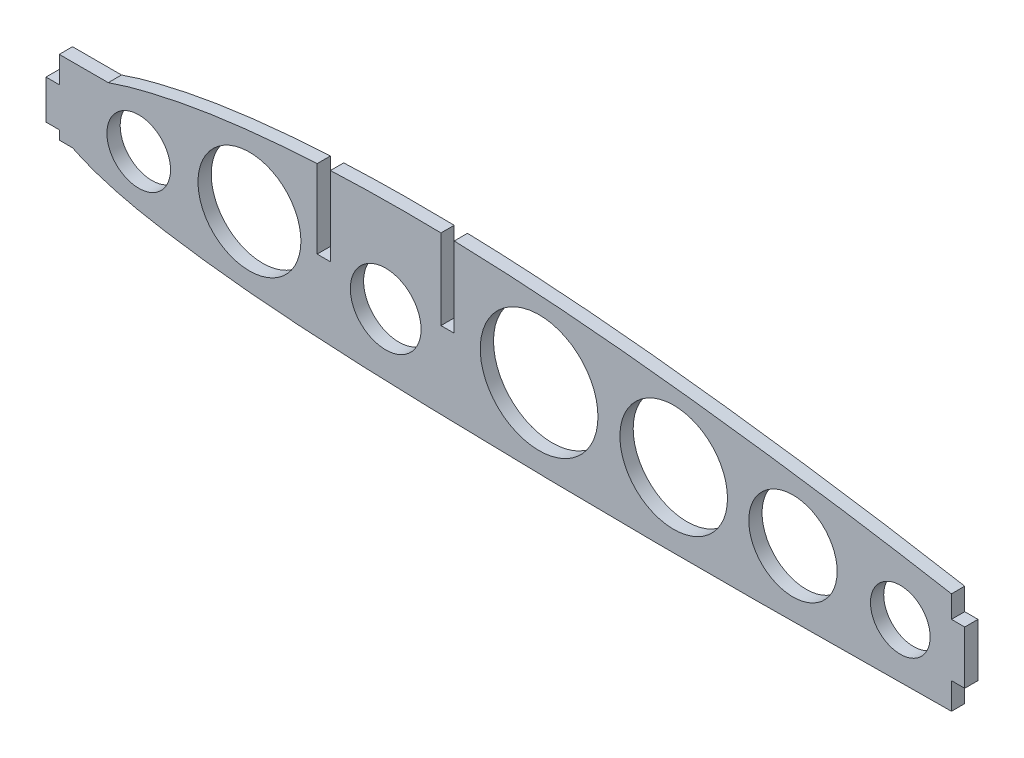
from build123d import *

# Parameters (mm, degrees)
STOCK_WING_STRUCTURESIZING_1_START = 350.5
STOCK_WING_STRUCTURESIZING_1_DEPTH = 3
CUT_EXTRUDE2_DEPTH                 = 278.894871602
CUT_EXTRUDE2_DEPTH_BACK            = 278.894871602
SKETCH3_R                          = 8
SKETCH3_W                          = 3
SKETCH3_H                          = 18.234468085
CUT_EXTRUDE5_DEPTH                 = 278.894871602
CUT_EXTRUDE5_DEPTH_BACK            = 278.894871602
SKETCH6_W                          = 72
SKETCH6_H                          = 36.832163157
SKETCH7_W                          = 3
SKETCH7_H                          = 29.829109924
CUT_EXTRUDE6_DEPTH                 = 3
BOSS_EXTRUDE1_DEPTH                = 3
SKETCH9_R                          = 7.192226029
SKETCH9_R_2                        = 11.636406179
SKETCH9_R_3                        = 13.307061318
SKETCH9_R_4                        = 12.161876466
SKETCH9_R_5                        = 9.990979792
SKETCH9_R_6                        = 6.753270012
CUT_EXTRUDE7_DEPTH                 = 10


# Read off the part's stored shape, not the designer's step: Stock-Wing_structureSizing-1
with BuildPart() as part:
    # Stock-Wing_structureSizing-1 outline → Stock-Wing_structureSizing-1 (new body)
    with BuildSketch(Plane.XY.offset(STOCK_WING_STRUCTURESIZING_1_START)):
        with BuildLine():
            Line((276.744987748, -9.975467242), (276.744987748, -2.791972149))
            add(Edge.make_bspline(
                [(276.744987748, -2.791972149), (265.3857023, -0.102525952), (253.985388892, 2.407220527), (231.123115134, 7.137179769), (219.66894224, 9.35664169), (202.450532833, 12.449607831), (196.704666185, 13.440005467), (185.197495984, 15.322846112), (179.436018194, 16.214183509), (167.896810084, 17.893728146), (162.119320772, 18.683464695), (150.549559093, 20.169132171), (144.757676972, 20.867539393), (133.154760401, 22.142823058), (127.340720117, 22.719276226), (115.726117513, 23.709424358), (109.921864102, 24.123286294), (92.520744809, 25.054695045), (80.935765142, 25.255529424), (63.589579679, 24.723206588), (57.812696472, 24.40777964), (49.15741104, 23.667136334), (46.27396258, 23.376378774), (40.511150261, 22.68602794), (37.631848569, 22.284778258), (31.878918329, 21.331115885), (29.005409213, 20.775520933), (24.699904445, 19.815325722), (23.265457389, 19.476044022), (20.398415094, 18.74813831), (18.963740816, 18.357002163), (16.106748162, 17.497000764), (14.692710081, 17.03099603), (11.902486035, 16.004726933), (10.526189891, 15.444736939), (8.50012674, 14.509175123), (7.830361802, 14.183402304), (6.512563898, 13.477739544), (5.865248411, 13.093583044), (4.633392785, 12.255605476), (4.045066641, 11.801499914), (3.209118512, 11.061128735), (2.938431583, 10.804207958), (2.416562808, 10.265550671), (2.165207772, 9.983507914), (1.696102707, 9.397220013), (1.477442994, 9.09171798), (1.085439515, 8.447078561), (0.915512906, 8.113897404), (0.714798114, 7.59155933), (0.657190766, 7.413573783), (0.566275814, 7.047480769), (0.533643429, 6.859526942), (0.498702003, 6.485823786), (0.495732967, 6.298500114), (0.52230969, 5.922794269), (0.553180601, 5.733657444), (0.641956646, 5.367254731), (0.699629973, 5.188174612), (0.835770495, 4.836464845), (0.914681224, 4.663114785), (1.173802922, 4.160517642), (1.376431151, 3.845824341), (1.822835658, 3.244491079), (2.068245893, 2.956719217), (2.585349641, 2.410512622), (2.856205808, 2.152934366), (3.699269455, 1.418677094), (4.302923323, 0.981675809), (5.262649419, 0.394618321), (5.591648375, 0.21018796), (6.254696782, -0.135942129), (6.589931521, -0.298692503), (7.602521133, -0.767803382), (8.28593821, -1.057311971), (9.662885491, -1.60821635), (10.357226689, -1.867357708), (12.455074514, -2.603572901), (13.873250521, -3.039868309), (16.739197416, -3.830190303), (18.188973825, -4.184254143), (22.54237297, -5.143962802), (25.459339583, -5.655261329), (31.306270814, -6.564233952), (34.235701619, -6.966574468), (40.104165427, -7.687316125), (43.043386977, -8.004069053), (51.874086741, -8.840379009), (57.778366073, -9.248032718), (66.64804678, -9.743583642), (69.60756187, -9.887823594), (75.525585547, -10.141245843), (78.484610817, -10.250077692), (84.402679828, -10.443151081), (87.361723417, -10.527595381), (93.279819329, -10.684856962), (96.238871496, -10.7578835), (111.034153794, -11.094438823), (122.870449548, -11.270610432), (140.625005024, -11.385979432), (146.54320834, -11.400264082), (158.379650661, -11.381324799), (164.297889136, -11.348805922), (176.134384089, -11.259801078), (182.052639742, -11.204415721), (193.889154401, -11.089178887), (199.807414258, -11.02819544), (217.562198328, -10.839257795), (229.398721047, -10.713290888), (253.0718283, -10.379069852), (264.908412973, -10.164021277), (276.744987748, -9.975467242)],
                knots=[0, 0, 0, 0, 0.0625, 0.0625, 0.125, 0.125, 0.15625, 0.15625, 0.1875, 0.1875, 0.21875, 0.21875, 0.25, 0.25, 0.28125, 0.28125, 0.3125, 0.3125, 0.375, 0.375, 0.40625, 0.40625, 0.421875, 0.421875, 0.4375, 0.4375, 0.453125, 0.453125, 0.4609375, 0.4609375, 0.46875, 0.46875, 0.4765625, 0.4765625, 0.484375, 0.484375, 0.48828125, 0.48828125, 0.4921875, 0.4921875, 0.49609375, 0.49609375, 0.498046875, 0.498046875, 0.5, 0.5, 0.501953125, 0.501953125, 0.50390625, 0.50390625, 0.504882813, 0.504882813, 0.505859375, 0.505859375, 0.506835938, 0.506835938, 0.5078125, 0.5078125, 0.508789063, 0.508789063, 0.509765625, 0.509765625, 0.51171875, 0.51171875, 0.513671875, 0.513671875, 0.515625, 0.515625, 0.51953125, 0.51953125, 0.521484375, 0.521484375, 0.5234375, 0.5234375, 0.52734375, 0.52734375, 0.53125, 0.53125, 0.5390625, 0.5390625, 0.546875, 0.546875, 0.5625, 0.5625, 0.578125, 0.578125, 0.59375, 0.59375, 0.625, 0.625, 0.640625, 0.640625, 0.65625, 0.65625, 0.671875, 0.671875, 0.6875, 0.6875, 0.75, 0.75, 0.78125, 0.78125, 0.8125, 0.8125, 0.84375, 0.84375, 0.875, 0.875, 0.9375, 0.9375, 1, 1, 1, 1], degree=3))
        make_face()
    extrude(amount=STOCK_WING_STRUCTURESIZING_1_DEPTH)

    # Sketch3 → Cut-Extrude2 (cut, two sides: drawn at the far end of the back side and taken through both)
    with BuildSketch(Plane.XY.offset(353.5).offset(-CUT_EXTRUDE2_DEPTH_BACK)):
        with Locations((76.810751166, 3.840845639)):
            Circle(SKETCH3_R)
        with Locations((62.810751166, 15.958079682)):
            Rectangle(SKETCH3_W, SKETCH3_H)
        with Locations((90.810751166, 15.958079682)):
            Rectangle(SKETCH3_W, SKETCH3_H)
    extrude(amount=CUT_EXTRUDE2_DEPTH + CUT_EXTRUDE2_DEPTH_BACK, mode=Mode.SUBTRACT)

    # Sketch6 → Cut-Extrude5 (cut, two sides: drawn at the far end of the back side and taken through both)
    with BuildSketch(Plane.XY.offset(353.5).offset(-CUT_EXTRUDE5_DEPTH_BACK)):
        with Locations((240.744987748, -6.383719695)):
            Rectangle(SKETCH6_W, SKETCH6_H)
    extrude(amount=CUT_EXTRUDE5_DEPTH + CUT_EXTRUDE5_DEPTH_BACK, mode=Mode.SUBTRACT)

    # Sketch7 → Cut-Extrude6 (cut)
    with BuildSketch(Plane.XY.offset(353.5)):
        with Locations((1.5, 14.914554962)):
            Rectangle(SKETCH7_W, SKETCH7_H)
    extrude(amount=-CUT_EXTRUDE6_DEPTH, mode=Mode.SUBTRACT)

    # Sketch8 → Boss-Extrude1 (add)
    with BuildSketch(Plane.XY.offset(353.5)):
        Polygon((14.079741692, 16.8), (3, 16.8), (3, 10.856999155), (0, 10.856999155), (0, 2.029447684), (3, 2.029447684), (3, 0), (5.994622402, 0), align=None)
        Polygon((204.744998472, 7.032361884), (207.744998472, 7.032361884), (207.744998472, -4.967638116), (204.744998472, -4.967638116), (202.527550965, -4.967638116), (202.527550965, 7.032361884), align=None)
    extrude(amount=-BOSS_EXTRUDE1_DEPTH)

    # Sketch9 → Cut-Extrude7 (cut)
    with BuildSketch(Plane.XY.offset(353.5)):
        with Locations((20.96232931, 6.753270012)):
            Circle(SKETCH9_R)
        with Locations((46.004691522, 7.523804234)):
            Circle(SKETCH9_R_2)
        with Locations((111.500100385, 6.753270012)):
            Circle(SKETCH9_R_3)
        with Locations((141.93620215, 5.404835124)):
            Circle(SKETCH9_R_4)
        with Locations((168.904899918, 3.478499569)):
            Circle(SKETCH9_R_5)
        with Locations((193.176727908, 1.166896903)):
            Circle(SKETCH9_R_6)
    extrude(amount=-CUT_EXTRUDE7_DEPTH, mode=Mode.SUBTRACT)


solid = part.part
